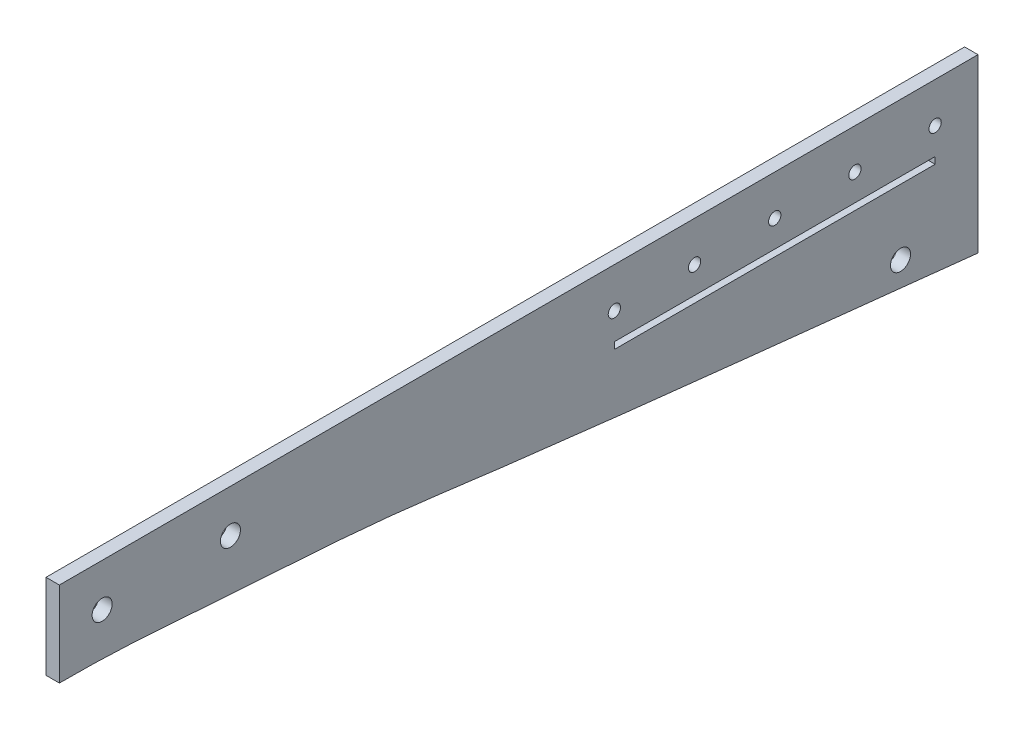
from build123d import *

# Parameters (mm, degrees)
SKETCH1_R           = 1.4605
SKETCH1_R_2         = 2.38125
SKETCH1_W           = 76.2
SKETCH1_H           = 1.5875
BOSS_EXTRUDE1_DEPTH = 3.175


with BuildPart() as part:
    # Sketch1 → Boss-Extrude1 (new body)
    with BuildSketch(Plane(origin=(0, 0, -187.325), x_dir=(0, 0, 1), z_dir=(-1, 0, 0))):
        with BuildLine():
            Line((104.70984031, 63.5), (-113.533003978, 63.5))
            Line((-113.533003978, 63.5), (-113.533003978, 22.683614274))
            add(Edge.make_bspline(
                [(104.70984031, 43.322928246), (97.292428523, 43.369222767), (86.485562122, 42.947747635), (59.066875535, 40.734135472), (33.287431115, 39.5878223), (-16.446460986, 32.848239562), (-71.701017552, 27.184558545), (-112.180029797, 22.829441378), (-113.533003978, 22.683614274)],
                knots=[0.290535466, 0.290535466, 0.290535466, 0.290535466, 0.346598052, 0.372016829, 0.495604882, 0.537891493, 0.752596324, 0.760056632, 0.760056632, 0.760056632, 0.760056632], degree=3))
            Line((104.70984031, 43.322928246), (104.70984031, 63.5))
        make_face()
        with Locations((-84.295733083, 53.975)):
            Circle(SKETCH1_R, mode=Mode.SUBTRACT)
        with Locations((-46.195733083, 53.975)):
            Circle(SKETCH1_R, mode=Mode.SUBTRACT)
        with Locations((-27.145733083, 53.975)):
            Circle(SKETCH1_R, mode=Mode.SUBTRACT)
        with Locations((64.06984031, 53.34)):
            Circle(SKETCH1_R_2, mode=Mode.SUBTRACT)
        with Locations((94.54984031, 53.34)):
            Circle(SKETCH1_R_2, mode=Mode.SUBTRACT)
        with Locations((-103.345733083, 53.975)):
            Circle(SKETCH1_R, mode=Mode.SUBTRACT)
        with Locations((-95.118003978, 30.48)):
            Circle(SKETCH1_R_2, mode=Mode.SUBTRACT)
        with Locations((-65.245733083, 53.975)):
            Circle(SKETCH1_R, mode=Mode.SUBTRACT)
        with Locations((-65.245733083, 46.83125)):
            Rectangle(SKETCH1_W, SKETCH1_H, mode=Mode.SUBTRACT)
    extrude(amount=BOSS_EXTRUDE1_DEPTH)


solid = part.part
